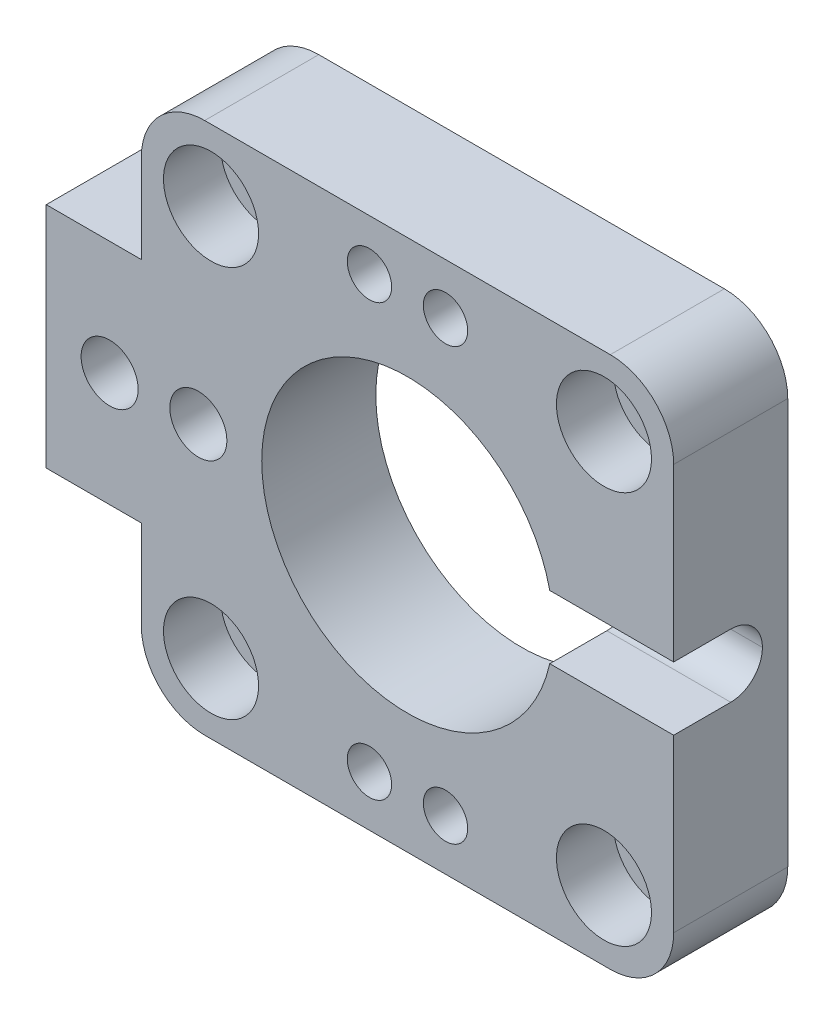
from build123d import *

# Parameters (mm, degrees)
ESQUISSE1_W             = 42
ESQUISSE1_H             = 42
ESQUISSE1_R             = 11.5
ESQUISSE1_R_2           = 1.75
ESQUISSE1_W_2           = 7.5
ESQUISSE1_H_2           = 18
BOSS_EXTRU_1_DEPTH      = 9
ESQUISSE9_R             = 2.25
ENL_V_MAT_EXTRU_2_DEPTH = 17
ENL_V_MAT_EXTRU_3_DEPTH = 4.5
ESQUISSE11_R            = 3.75
ENL_V_MAT_EXTRU_4_DEPTH = 4.5
CONG_1_R                = 5
ESQUISSE12_R            = 1.75
ENL_V_MAT_EXTRU_5_DEPTH = 10
ENL_V_MAT_EXTRU_8_DEPTH = 4.5
ESQUISSE15_W            = 7
ESQUISSE15_H            = 5
ENL_V_MAT_EXTRU_9_DEPTH = 10
CONG_2_R                = 2.5


with BuildPart() as part:
    # Esquisse1 → Boss.-Extru.1 (new body)
    # profile 1 of 2: a face of its own
    with BuildSketch(Plane.XY):
        with Locations((-21, -21)):
            Rectangle(ESQUISSE1_W, ESQUISSE1_H)
        with Locations((-21, -21)):
            Circle(ESQUISSE1_R, mode=Mode.SUBTRACT)
        with Locations((-36.5, -36.5)):
            Circle(ESQUISSE1_R_2, mode=Mode.SUBTRACT)
        with Locations((-5.5, -36.5)):
            Circle(ESQUISSE1_R_2, mode=Mode.SUBTRACT)
        with Locations((-5.5, -5.5)):
            Circle(ESQUISSE1_R_2, mode=Mode.SUBTRACT)
        with Locations((-36.5, -5.611040912)):
            Circle(ESQUISSE1_R_2, mode=Mode.SUBTRACT)
    # profile 2 of 2: a face of its own
    with BuildSketch(Plane.XY):
        with Locations((-45.75, -21)):
            Rectangle(ESQUISSE1_W_2, ESQUISSE1_H_2)
    extrude(amount=BOSS_EXTRU_1_DEPTH)

    # Esquisse9 → Enlèv. mat.-Extru.2 (cut)
    with BuildSketch(Plane.XY.offset(9)):
        with Locations((-44.5, -21)):
            Circle(ESQUISSE9_R)
        with Locations((-37.5, -21)):
            Circle(ESQUISSE9_R)
    extrude(amount=-ENL_V_MAT_EXTRU_2_DEPTH, mode=Mode.SUBTRACT)

    # Esquisse10 → Enlèv. mat.-Extru.3 (cut)
    with BuildSketch(Plane(origin=(0, 0, 0), x_dir=(-1, 0, 0), z_dir=(0, 0, -1))):
        Polygon((44.5, -25.330127019), (48.25, -23.165063509), (48.25, -18.834936491), (44.5, -16.669872981), (40.75, -18.834936491), (40.75, -23.165063509), align=None)
        Polygon((37.5, -25.330127019), (41.25, -23.165063509), (41.25, -18.834936491), (37.5, -16.669872981), (33.75, -18.834936491), (33.75, -23.165063509), align=None)
    extrude(amount=-ENL_V_MAT_EXTRU_3_DEPTH, mode=Mode.SUBTRACT)

    # Esquisse11 → Enlèv. mat.-Extru.4 (cut)
    with BuildSketch(Plane.XY.offset(9)):
        with Locations((-36.5, -5.611040912)):
            Circle(ESQUISSE11_R)
        with Locations((-5.5, -5.5)):
            Circle(ESQUISSE11_R)
        with Locations((-5.5, -36.5)):
            Circle(ESQUISSE11_R)
        with Locations((-36.5, -36.5)):
            Circle(ESQUISSE11_R)
    extrude(amount=-ENL_V_MAT_EXTRU_4_DEPTH, mode=Mode.SUBTRACT)

    # Congé1
    cong_1_edges = [part.edges().sort_by_distance(p)[0] for p in [
        (0, 0, 4.5),
        (0, -42, 4.5),
        (-42, -42, 4.5),
        (-42, 0, 4.5),
    ]]
    fillet(cong_1_edges, radius=CONG_1_R)

    # Esquisse12 → Enlèv. mat.-Extru.5 (cut)
    with BuildSketch(Plane.XY.offset(9)):
        with Locations((-24, -38)):
            Circle(ESQUISSE12_R)
        with Locations((-18, -38)):
            Circle(ESQUISSE12_R)
        with Locations((-24, -4)):
            Circle(ESQUISSE12_R)
        with Locations((-18, -4)):
            Circle(ESQUISSE12_R)
    extrude(amount=-ENL_V_MAT_EXTRU_5_DEPTH, mode=Mode.SUBTRACT)

    # Esquisse14 → Enlèv. mat.-Extru.8 (cut)
    with BuildSketch(Plane(origin=(0, 0, 0), x_dir=(-1, 0, 0), z_dir=(0, 0, -1))):
        Polygon((27, -39.732050808), (27, -36.267949192), (24, -34.535898385), (21, -36.267949192), (18, -34.535898385), (15, -36.267949192), (15, -39.732050808), (18, -41.464101615), (21, -39.732050808), (24, -41.464101615), align=None)
        Polygon((27, -5.732050808), (27, -2.267949192), (24, -0.535898385), (21, -2.267949192), (18, -0.535898385), (15, -2.267949192), (15, -5.732050808), (18, -7.464101615), (21, -5.732050808), (24, -7.464101615), align=None)
    extrude(amount=-ENL_V_MAT_EXTRU_8_DEPTH, mode=Mode.SUBTRACT)

    # Esquisse15 → Enlèv. mat.-Extru.9 (cut)
    with BuildSketch(Plane(origin=(0, 0, 0), x_dir=(0, 0, -1), z_dir=(1, 0, 0))):
        with Locations((-5.5, -21)):
            Rectangle(ESQUISSE15_W, ESQUISSE15_H)
    extrude(amount=-ENL_V_MAT_EXTRU_9_DEPTH, mode=Mode.SUBTRACT)

    # Congé2
    cong_2_edges = [part.edges().sort_by_distance(p)[0] for p in [
        (-4.88751392, -23.5, 2),
        (-4.88751392, -18.5, 2),
    ]]
    fillet(cong_2_edges, radius=CONG_2_R - 0.0001)  # a hair under: the kernel refuses the full size


solid = part.part
